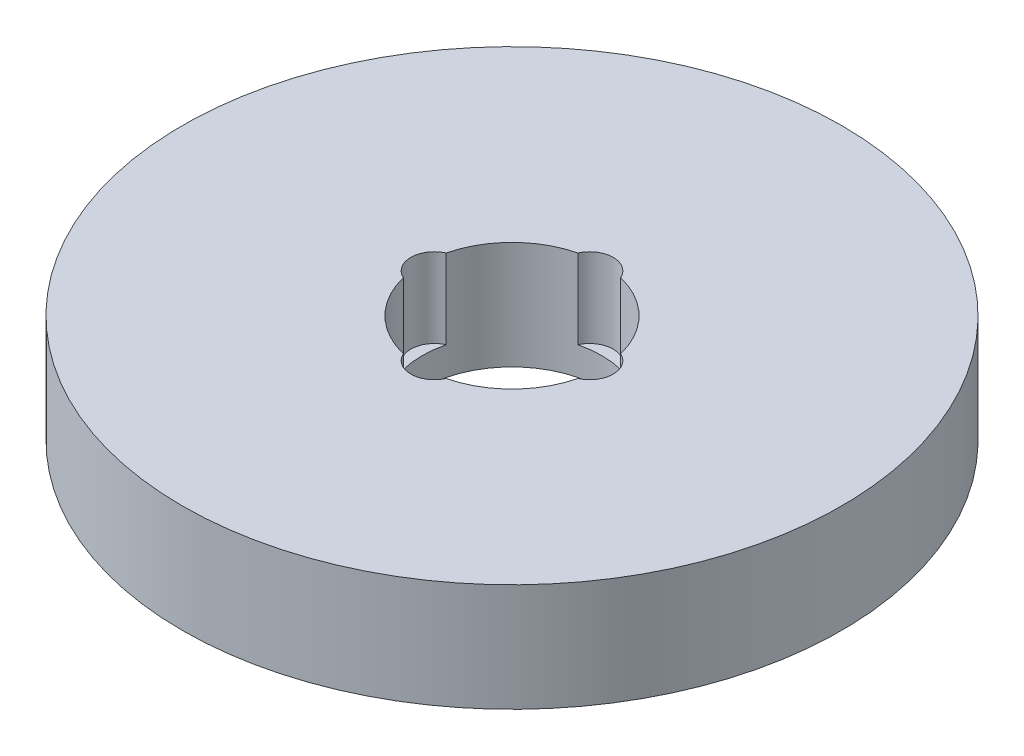
from build123d import *

# Parameters (mm, degrees)
SKETCH1_R           = 82.5
BOSS_EXTRUDE1_DEPTH = 27
SKETCH2_R           = 22.5
CUT_EXTRUDE1_DEPTH  = 120.756001937
SKETCH3_R           = 5.867493476
CUT_EXTRUDE2_DEPTH  = 19.896726742
CIRPATTERN1_COUNT   = 4


with BuildPart() as part:
    # Sketch1 → Boss-Extrude1 (new body)
    with BuildSketch(Plane(origin=(0, 0, 0), x_dir=(1, 0, 0), z_dir=(0, 1, 0))):
        Circle(SKETCH1_R)
    extrude(amount=BOSS_EXTRUDE1_DEPTH)

    # Sketch2 → Cut-Extrude1 (cut, through all)
    with BuildSketch(Plane(origin=(0, 0, 0), x_dir=(1, 0, 0), z_dir=(0, 1, 0))):
        Circle(SKETCH2_R)
    extrude(amount=CUT_EXTRUDE1_DEPTH, mode=Mode.SUBTRACT)

    # Sketch3 → Cut-Extrude2 (cut)
    with BuildSketch(Plane(origin=(0, 27, 0), x_dir=(1, 0, 0), z_dir=(0, 1, 0))):
        with Locations((-19.451152167, 0)):
            Circle(SKETCH3_R)
    cut_extrude2 = extrude(amount=-CUT_EXTRUDE2_DEPTH, mode=Mode.SUBTRACT)

    # CirPattern1: Cut-Extrude2 ×4 about axis
    cirpattern1_axis = Axis((0, 0, 0), (0, 1, 0))
    for i in range(1, CIRPATTERN1_COUNT):
        add(cut_extrude2.rotate(cirpattern1_axis, i * 360 / CIRPATTERN1_COUNT), mode=Mode.SUBTRACT)


solid = part.part
